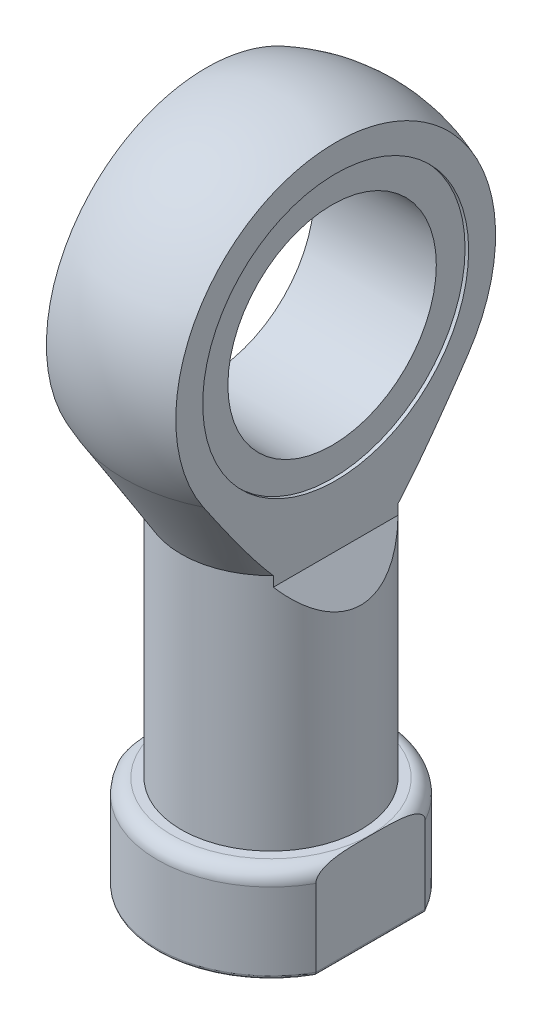
from build123d import *

# Parameters (mm, degrees)
SKETCH2_OUTSIDE_W        = 37.758
SKETCH2_OUTSIDE_H        = 37.758
CUT_EXTRUDE1_DEPTH       = 6.6
SKETCH3_OUTSIDE_W        = 37.758
SKETCH3_OUTSIDE_H        = 37.758
SKETCH3_OUTSIDE_W_2      = 9
SKETCH3_OUTSIDE_H_2      = 24
CUT_EXTRUDE2_DEPTH       = 31.630866785
SKETCH4_R                = 9.25
SKETCH4_R_2              = 7.25
CUT_EXTRUDE3_DEPTH       = 0.25
CUT_EXTRUDE4_START       = -0.25
SKETCH5_R                = 9.25
SKETCH5_R_2              = 7.25
CUT_EXTRUDE4_DEPTH       = 0.25
DOME2_FACE_RADIUS        = 7.25
DOME2_HEIGHT             = 3.8
FILLET1_R                = 1
FILLET2_R                = 0.25
CUT_EXTRUDE10_DEPTH      = 10.2995
M8_TAPPED_HOLE1_D        = 6.8
M8_TAPPED_HOLE1_DEPTH    = 22.25
M8_TAPPED_HOLE1_TIP      = 2.042926105
CUT_EXTRUDE11_DEPTH      = 51.168615687
CUT_EXTRUDE11_DEPTH_BACK = 51.168615687
SKETCH6_R                = 7.25


# Read off the part's stored shape, not the designer's step: Dome1
with BuildPart() as part:
    # Sketch1 → Revolve1 (revolve)
    with BuildSketch(Plane(origin=(0, 0, 0), x_dir=(0, 0, -1), z_dir=(1, 0, 0)), mode=Mode.PRIVATE) as revolve1_sk:
        with BuildLine():
            Line((0, 0), (7.9, 0))
            Line((7.9, 0), (7.9, 6.6))
            Line((7.9, 6.6), (6.25, 6.6))
            Line((6.25, 6.6), (6.25, 23.2))
            Line((6.25, 23.2), (10.245555029, 29.752712416))
            ThreePointArc((10.245555029, 29.752712416), (10.463447114, 41.875055276), (0, 48))
            Line((0, 48), (0, 0))
        make_face()
    revolve(revolve1_sk.sketch.rotate(Axis((0, 48, 0), (0, -1, 0)), 180), axis=Axis((0, 48, 0), (0, -1, 0)))

    # Sketch2 outside → Cut-Extrude1 (cut)
    with BuildSketch(Plane(origin=(0, 0, 0), x_dir=(-1, 0, 0), z_dir=(0, -1, 0))):
        Rectangle(SKETCH2_OUTSIDE_W, SKETCH2_OUTSIDE_H)
        with BuildLine():
            Line((-6.925, 3.801890977), (-6.925, -3.801890977))
            ThreePointArc((-6.925, -3.801890977), (0, -7.9), (6.925, -3.801890977))
            Line((6.925, -3.801890977), (6.925, 3.801890977))
            ThreePointArc((6.925, 3.801890977), (0, 7.9), (-6.925, 3.801890977))
        make_face(mode=Mode.SUBTRACT)
    extrude(amount=-CUT_EXTRUDE1_DEPTH, mode=Mode.SUBTRACT)

    # Sketch3 outside → Cut-Extrude2 (cut, through all)
    with BuildSketch(Plane(origin=(0, 22.5, 0), x_dir=(-1, 0, 0), z_dir=(0, -1, 0))):
        Rectangle(SKETCH3_OUTSIDE_W, SKETCH3_OUTSIDE_H)
        Rectangle(SKETCH3_OUTSIDE_W_2, SKETCH3_OUTSIDE_H_2, mode=Mode.SUBTRACT)
    extrude(amount=-CUT_EXTRUDE2_DEPTH, mode=Mode.SUBTRACT)

    # Sketch4 → Cut-Extrude3 (cut)
    with BuildSketch(Plane(origin=(4.5, 0, 0), x_dir=(0, 0, -1), z_dir=(1, 0, 0))):
        with Locations((0, 36)):
            Circle(SKETCH4_R)
        with Locations((0, 36)):
            Circle(SKETCH4_R_2, mode=Mode.SUBTRACT)
    extrude(amount=-CUT_EXTRUDE3_DEPTH, mode=Mode.SUBTRACT)

    # Sketch5 → Cut-Extrude4 (cut)
    with BuildSketch(Plane.ZY.offset(4.5).offset(CUT_EXTRUDE4_START)):
        with Locations(Location((0, 36, 0), (0, 0, 180))):
            Circle(SKETCH5_R)
        with Locations(Location((0, 36, 0), (0, 0, 180))):
            Circle(SKETCH5_R_2, mode=Mode.SUBTRACT)
    extrude(amount=CUT_EXTRUDE4_DEPTH, mode=Mode.SUBTRACT)

    # Dome1 outline → Dome1 (revolve)
    with BuildSketch(Plane(origin=(0, 36, 0), x_dir=(0, 1, 0), z_dir=(0, 0, -1))):
        with BuildLine():
            Line((0, -4.499999993), (0, -8.3))
            ThreePointArc((0, -8.3), (4.092752745, -7.292422991), (7.250000005, -4.499999993))
            Line((7.250000005, -4.499999993), (0, -4.499999993))
        make_face()
    revolve(axis=Axis((0, 36, 0), (1, 0, 0)))

    # Dome2: a dome of height H over a round flat face of radius A is a cap of a sphere of radius (A * A + H * H) / (2 * H)
    dome2_r = (DOME2_FACE_RADIUS * DOME2_FACE_RADIUS + DOME2_HEIGHT * DOME2_HEIGHT) / (2 * DOME2_HEIGHT)
    dome2_base = Plane((4.5, 36, 0), z_dir=(1, 0, 0))
    with Locations(dome2_base.offset(DOME2_HEIGHT - dome2_r)):
        dome2_ball = Sphere(dome2_r, mode=Mode.PRIVATE)
    add(split(dome2_ball, bisect_by=dome2_base, keep=Keep.TOP, mode=Mode.PRIVATE))

    # Fillet1
    # the kernel refuses this fillet: 1 mm, written as the material it takes off along each edge
    with BuildSketch(Plane(origin=(0, 6.6, 0), x_dir=(-0.9669082627273712, 0, 0.25512430591681584), z_dir=(0.25512430591681584, 0, 0.9669082627273712))) as fillet1_piece_1:
        with BuildLine():
            CenterArc((7.9 - FILLET1_R, FILLET1_R), FILLET1_R, 270, 90)
            Line((7.9, FILLET1_R), (7.9 + FILLET1_R * 0.02, FILLET1_R))
            Line((7.9 + FILLET1_R * 0.02, FILLET1_R), (7.9 + FILLET1_R * 0.02, -FILLET1_R * 0.02))
            Line((7.9 + FILLET1_R * 0.02, -FILLET1_R * 0.02), (7.9 - FILLET1_R, -FILLET1_R * 0.02))
            Line((7.9 - FILLET1_R, -FILLET1_R * 0.02), (7.9 - FILLET1_R, 0))
        make_face()
    revolve(axis=Axis((0, 6.6, 0), (0, -1, 0)), revolution_arc=209.561901965, mode=Mode.SUBTRACT)
    with BuildSketch(Plane(origin=(0, 6.6, 0), x_dir=(-0.9669082627273712, 0, -0.2551243059168157), z_dir=(0.2551243059168157, 0, -0.9669082627273712))) as fillet1_piece_2:
        with BuildLine():
            CenterArc((7.9 - FILLET1_R, -FILLET1_R), FILLET1_R, 360, 90)
            Line((7.9, -FILLET1_R), (7.9 + FILLET1_R * 0.02, -FILLET1_R))
            Line((7.9 + FILLET1_R * 0.02, -FILLET1_R), (7.9 + FILLET1_R * 0.02, FILLET1_R * 0.02))
            Line((7.9 + FILLET1_R * 0.02, FILLET1_R * 0.02), (7.9 - FILLET1_R, FILLET1_R * 0.02))
            Line((7.9 - FILLET1_R, FILLET1_R * 0.02), (7.9 - FILLET1_R, 0))
        make_face()
    revolve(axis=Axis((0, 6.6, 0), (0, 1, 0)), revolution_arc=209.561901965, mode=Mode.SUBTRACT)

    # Fillet2
    fillet2_edges = [part.edges().sort_by_distance(p)[0] for p in [
        (0, 0, -7.9),
        (0, 0, 7.9),
        (6.925, 0, 0),
        (-6.925, 0, 0),
    ]]
    fillet(fillet2_edges, radius=FILLET2_R)

    # Sketch11 → Cut-Extrude10 (cut, symmetric)
    with BuildSketch(Plane(origin=(0, 0, 0), x_dir=(-1, 0, 0), z_dir=(0, 0, -1))):
        Polygon((-6.25, 22.5), (-4.5, 22.5), (-6.25, 20.127174391), align=None)
        Polygon((4.5, 22.5), (6.25, 22.5), (6.25, 20.127174391), align=None)
    extrude(amount=CUT_EXTRUDE10_DEPTH, both=True, mode=Mode.SUBTRACT)

    # M8 Tapped Hole1
    with Locations(Plane(origin=(0, -4.5, 0), x_dir=(-1, 0, 0), z_dir=(0, -1, 0))):
        with Locations((0, 0)):
            Hole(M8_TAPPED_HOLE1_D / 2, depth=M8_TAPPED_HOLE1_DEPTH)
            with Locations((0, 0, -(M8_TAPPED_HOLE1_DEPTH + M8_TAPPED_HOLE1_TIP / 2))):  # 118° drill point
                Cone(0, M8_TAPPED_HOLE1_D / 2, M8_TAPPED_HOLE1_TIP, mode=Mode.SUBTRACT)

    # Sketch6 → Cut-Extrude11 (cut, two sides: drawn at the far end of the back side and taken through both)
    with BuildSketch(Plane(origin=(0, 0, 0), x_dir=(0, 0, -1), z_dir=(1, 0, 0)).offset(-CUT_EXTRUDE11_DEPTH_BACK)):
        with Locations((0, 36)):
            Circle(SKETCH6_R)
    extrude(amount=CUT_EXTRUDE11_DEPTH + CUT_EXTRUDE11_DEPTH_BACK, mode=Mode.SUBTRACT)


solid = part.part
